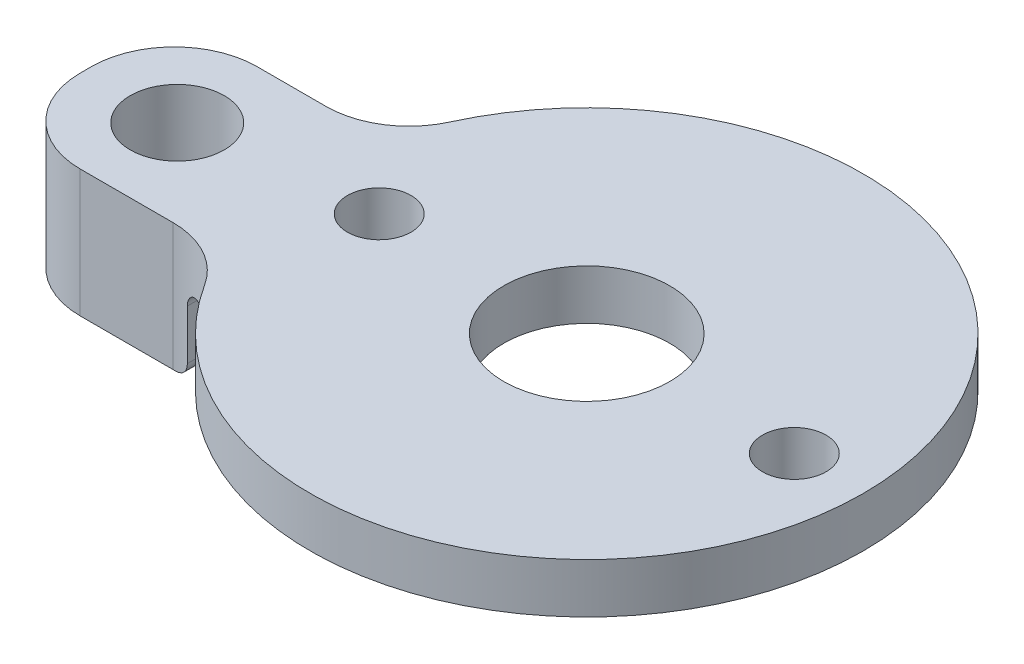
from build123d import *
from build123d.topology import SkipClean

# Parameters (mm, degrees)
SKETCH1_R           = 3.81
SKETCH1_R_2         = 1.4605
SKETCH1_R_3         = 2.159
BOSS_EXTRUDE1_DEPTH = 2.286
BOSS_EXTRUDE2_START = 3.556
SKETCH3_W           = 8.798430976
SKETCH3_H           = 8.128
SKETCH3_R           = 2.159
BOSS_EXTRUDE2_DEPTH = 3.556
FILLET1_R           = 3.81
FILLET2_R           = 3.81
FILLET3_R           = 0.635


with BuildPart() as part:
    # Sketch1 → Boss-Extrude1 (new body)
    with BuildSketch(Plane(origin=(0, 0, 0), x_dir=(1, 0, 0), z_dir=(0, 1, 0))):
        with BuildLine():
            Line((-12.328815677, 3.048), (-21.980815677, 3.048))
            Line((-21.980815677, 3.048), (-21.980815677, -5.08))
            Line((-21.980815677, -5.08), (-11.639742265, -5.08))
            ThreePointArc((-11.639742265, -5.08), (12.654605425, 1.072828757), (-12.328815677, 3.048))
        make_face()
        with Locations(Location((0, 0, 0), (0, 0, 270))):
            Circle(SKETCH1_R, mode=Mode.SUBTRACT)
        with Locations(Location((9.525, 0, 0), (0, 0, 270))):
            Circle(SKETCH1_R_2, mode=Mode.SUBTRACT)
        with Locations(Location((-9.525, 0, 0), (0, 0, 270))):
            Circle(SKETCH1_R_2, mode=Mode.SUBTRACT)
        with Locations(Location((-17.78, -1.016, 0), (0, 0, 270))):
            Circle(SKETCH1_R_3, mode=Mode.SUBTRACT)
    extrude(amount=BOSS_EXTRUDE1_DEPTH)

    # Sketch3 → Boss-Extrude2 (add)
    with SkipClean():  # the faces are left unmerged after this step: merging them gives an invalid solid
        with BuildSketch(Plane.XZ.offset(BOSS_EXTRUDE2_START)):
            with Locations((-17.581600189, 1.016)):
                Rectangle(SKETCH3_W, SKETCH3_H)
            with Locations(Location((-17.78, 1.016, 0), (0, 0, 270))):
                Circle(SKETCH3_R, mode=Mode.SUBTRACT)
        extrude(amount=-BOSS_EXTRUDE2_DEPTH)

    # Fillet1
    fillet1_edges = [part.edges().sort_by_distance(p)[0] for p in [
        (-21.980815677, -1.778, 5.08),
        (-21.980815677, -1.778, -3.048),
    ]]
    fillet(fillet1_edges, radius=FILLET1_R)

    # Fillet2
    # the kernel refuses this fillet: 3.81 mm, written as the material it adds along each edge
    with BuildSketch(Plane(origin=(-12.328815677, -6.723594375, -3.048), x_dir=(-1, 0, 0), z_dir=(0, 1, 0))) as fillet2_piece_1_section:
        with BuildLine():
            CenterArc((2.68943775, -3.81), FILLET2_R, 90, 65.456460121)
            ThreePointArc((-0.776313041, -2.227384615), (-0.336332546, -1.13175458), (0, 0))
            Line((0, 0), (2.68943775, 0))
        make_face()
    fillet2_piece_1 = extrude(amount=9.009594375, mode=Mode.PRIVATE)
    fillet2_piece_1 = split(fillet2_piece_1, bisect_by=Plane(origin=(-13.789984069, 0, -3.128673841), z_dir=(0, -1, 0)), keep=Keep.TOP, mode=Mode.PRIVATE)
    fillet2_piece_1 = split(fillet2_piece_1, bisect_by=Plane(origin=(-13.789984069, -3.556, -3.128673841), z_dir=(0, 1, 0)), keep=Keep.TOP, mode=Mode.PRIVATE)
    fillet2_piece_1 = split(fillet2_piece_1, bisect_by=Plane(origin=(-13.182384701, -1.778, -3.128673841), z_dir=(-1, 0, 0)), keep=Keep.TOP, mode=Mode.PRIVATE)
    add(fillet2_piece_1)
    with BuildSketch(Plane(origin=(-12.328815677, 0, -3.048), x_dir=(-1, 0, 0), z_dir=(0, 1, 0))) as fillet2_piece_2_section:
        with BuildLine():
            CenterArc((2.68943775, -3.81), FILLET2_R, 90, 65.456460121)
            ThreePointArc((-0.776313041, -2.227384615), (-0.336332546, -1.13175458), (0, 0))
            Line((0, 0), (2.68943775, 0))
        make_face()
    fillet2_piece_2 = extrude(amount=2.286, mode=Mode.PRIVATE)
    fillet2_piece_2 = split(fillet2_piece_2, bisect_by=Plane(origin=(-13.182384701, 1.143, -3.128673841), z_dir=(-1, 0, 0)), keep=Keep.TOP, mode=Mode.PRIVATE)
    add(fillet2_piece_2)
    with BuildSketch(Plane(origin=(-12.328815677, 0, -3.048), x_dir=(-1, 0, 0), z_dir=(0, 1, 0))) as fillet2_piece_3_section:
        with BuildLine():
            CenterArc((2.68943775, -3.81), FILLET2_R, 90, 65.456460121)
            ThreePointArc((-0.776313041, -2.227384615), (-0.336332546, -1.13175458), (0, 0))
            Line((0, 0), (2.68943775, 0))
        make_face()
    fillet2_piece_3 = extrude(amount=2.286, mode=Mode.PRIVATE)
    fillet2_piece_3 = split(fillet2_piece_3, bisect_by=Plane(origin=(-13.182384701, 1.143, -3.680280143), z_dir=(1, 0, 0)), keep=Keep.TOP, mode=Mode.PRIVATE)
    add(fillet2_piece_3)
    with BuildSketch(Plane(origin=(-11.639742265, -5.681026739, 5.08), x_dir=(0.47068197991323696, 0, 0.8823029376495101), z_dir=(0, 1, 0))) as fillet2_piece_4_section:
        with BuildLine():
            CenterArc((2.291991427, -3.798252976), FILLET2_R, 94.500395957, 57.421029607)
            Line((-1.069582765, -2.004954632), (0, 0))
            ThreePointArc((0, 0), (0.996518012, -0.039156748), (1.993036024, 0))
        make_face()
    fillet2_piece_4 = extrude(amount=7.967026739, mode=Mode.PRIVATE)
    fillet2_piece_4 = split(fillet2_piece_4, bisect_by=Plane(origin=(-13.504288869, 0, 5.055827312), z_dir=(0, -1, 0)), keep=Keep.TOP, mode=Mode.PRIVATE)
    fillet2_piece_4 = split(fillet2_piece_4, bisect_by=Plane(origin=(-13.504288869, -3.556, 5.055827312), z_dir=(0, 1, 0)), keep=Keep.TOP, mode=Mode.PRIVATE)
    fillet2_piece_4 = split(fillet2_piece_4, bisect_by=Plane(origin=(-13.182384701, -1.778, 5.055827312), z_dir=(-1, 0, 0)), keep=Keep.TOP, mode=Mode.PRIVATE)
    add(fillet2_piece_4)
    with BuildSketch(Plane(origin=(-11.639742265, 0, 5.08), x_dir=(0.47068197991323696, 0, 0.8823029376495101), z_dir=(0, 1, 0))) as fillet2_piece_5_section:
        with BuildLine():
            CenterArc((2.291991427, -3.798252976), FILLET2_R, 94.500395957, 57.421029607)
            Line((-1.069582765, -2.004954632), (0, 0))
            ThreePointArc((0, 0), (0.996518012, -0.039156748), (1.993036024, 0))
        make_face()
    fillet2_piece_5 = extrude(amount=2.286, mode=Mode.PRIVATE)
    fillet2_piece_5 = split(fillet2_piece_5, bisect_by=Plane(origin=(-13.182384701, 1.143, 5.488267474), z_dir=(1, 0, 0)), keep=Keep.TOP, mode=Mode.PRIVATE)
    add(fillet2_piece_5)
    with BuildSketch(Plane(origin=(-11.639742265, 0, 5.08), x_dir=(0.47068197991323696, 0, 0.8823029376495101), z_dir=(0, 1, 0))) as fillet2_piece_6_section:
        with BuildLine():
            CenterArc((2.291991427, -3.798252976), FILLET2_R, 94.500395957, 57.421029607)
            Line((-1.069582765, -2.004954632), (0, 0))
            ThreePointArc((0, 0), (0.996518012, -0.039156748), (1.993036024, 0))
        make_face()
    fillet2_piece_6 = extrude(amount=2.286, mode=Mode.PRIVATE)
    fillet2_piece_6 = split(fillet2_piece_6, bisect_by=Plane(origin=(-13.182384701, 1.143, 5.055827312), z_dir=(-1, 0, 0)), keep=Keep.TOP, mode=Mode.PRIVATE)
    add(fillet2_piece_6)

    # Fillet3
    fillet3_edges = [part.edges().sort_by_distance(p)[0] for p in [
        (-13.182384701, -3.556, 0.815529295),
        (-13.182384701, 0, 0.815529295),
    ]]
    fillet(fillet3_edges, radius=FILLET3_R)


solid = part.part
